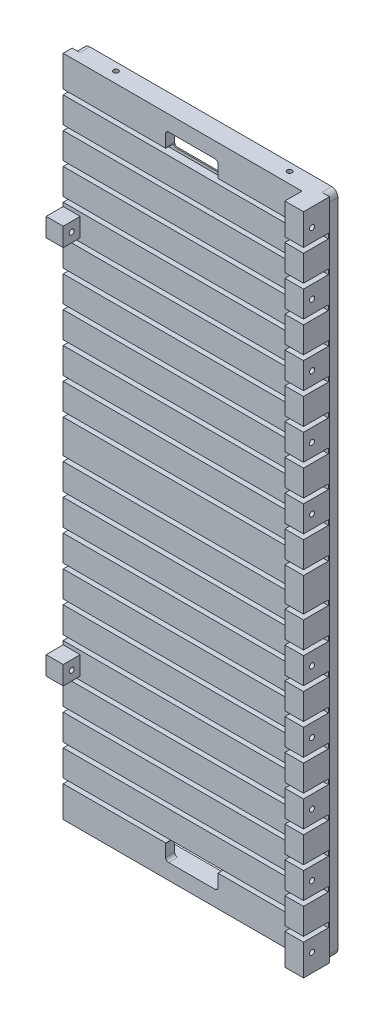
from build123d import *

# Parameters (mm, degrees)
SKETCH1_W                 = 83
SKETCH1_H                 = 214
BOSS_EXTRUDE1_DEPTH       = 8.4
SKETCH2_W                 = 77
SKETCH2_H                 = 5.5
CUT_EXTRUDE1_DEPTH        = 219.148596145
SKETCH3_W                 = 8
SKETCH3_H                 = 1.6
CUT_EXTRUDE2_DEPTH        = 136.678148572
LPATTERN1_COUNT           = 10
LPATTERN1_PITCH           = 10
MIRROR1_COPY_1_SKETCH_W   = 8
MIRROR1_COPY_1_SKETCH_H   = 1.6
MIRROR1_COPY_1_DEPTH      = 136.678148572
MIRROR1_COPY_2_SKETCH_W   = 8
MIRROR1_COPY_2_SKETCH_H   = 1.6
MIRROR1_COPY_2_DEPTH      = 136.678148572
MIRROR1_COPY_3_SKETCH_W   = 8
MIRROR1_COPY_3_SKETCH_H   = 1.6
MIRROR1_COPY_3_DEPTH      = 136.678148572
MIRROR1_COPY_4_SKETCH_W   = 8
MIRROR1_COPY_4_SKETCH_H   = 1.6
MIRROR1_COPY_4_DEPTH      = 136.678148572
MIRROR1_COPY_5_SKETCH_W   = 8
MIRROR1_COPY_5_SKETCH_H   = 1.6
MIRROR1_COPY_5_DEPTH      = 136.678148572
MIRROR1_COPY_6_SKETCH_W   = 8
MIRROR1_COPY_6_SKETCH_H   = 1.6
MIRROR1_COPY_6_DEPTH      = 136.678148572
MIRROR1_COPY_7_SKETCH_W   = 8
MIRROR1_COPY_7_SKETCH_H   = 1.6
MIRROR1_COPY_7_DEPTH      = 136.678148572
MIRROR1_COPY_8_SKETCH_W   = 8
MIRROR1_COPY_8_SKETCH_H   = 1.6
MIRROR1_COPY_8_DEPTH      = 136.678148572
MIRROR1_COPY_9_SKETCH_W   = 8
MIRROR1_COPY_9_SKETCH_H   = 1.6
MIRROR1_COPY_9_DEPTH      = 136.678148572
MIRROR1_COPY_10_SKETCH_W  = 8
MIRROR1_COPY_10_SKETCH_H  = 1.6
MIRROR1_COPY_10_DEPTH     = 136.678148572
BOSS_EXTRUDE2_DEPTH       = 3.18
SKETCH5_W                 = 5.5
SKETCH5_H                 = 6
BOSS_EXTRUDE3_DEPTH       = 5.5
CUT_EXTRUDE3_DEPTH        = 116.073063746
M2X0_4_TAPPED_HOLE1_D     = 1.6
M2X0_4_TAPPED_HOLE2_D     = 1.6
M2X0_4_TAPPED_HOLE2_DEPTH = 4
M2X0_4_TAPPED_HOLE2_TIP   = 0.480688495


with BuildPart() as part:
    # Sketch1 → Boss-Extrude1 (new body)
    with BuildSketch(Plane.XY):
        Rectangle(SKETCH1_W, SKETCH1_H)
    extrude(amount=BOSS_EXTRUDE1_DEPTH)

    # Sketch2 → Cut-Extrude1 (cut, through all)
    with BuildSketch(Plane(origin=(0, 107, 0), x_dir=(1, 0, 0), z_dir=(0, 1, 0))):
        with Locations((-3, -5.65)):
            Rectangle(SKETCH2_W, SKETCH2_H)
    extrude(amount=-CUT_EXTRUDE1_DEPTH, mode=Mode.SUBTRACT)

    # Sketch3 → Cut-Extrude2 (cut, through all)
    with BuildSketch(Plane(origin=(41.5, 0, 0), x_dir=(0, 0, -1), z_dir=(1, 0, 0))):
        with Locations((-4.4, 96.2)):
            Rectangle(SKETCH3_W, SKETCH3_H)
    cut_extrude2 = extrude(amount=-CUT_EXTRUDE2_DEPTH, mode=Mode.SUBTRACT)

    # LPattern1: Cut-Extrude2 ×10
    with Locations(*[(0, -i * LPATTERN1_PITCH, 0) for i in range(1, LPATTERN1_COUNT)]):
        add(cut_extrude2, mode=Mode.SUBTRACT)

    # Mirror1 copy 1 sketch → Mirror1 copy 1 (cut, through all)
    with BuildSketch(Plane(origin=(41.5, 10, 0), x_dir=(0, 0, -1), z_dir=(1, 0, 0))):
        with Locations((-4.4, -96.2)):
            Rectangle(MIRROR1_COPY_1_SKETCH_W, MIRROR1_COPY_1_SKETCH_H)
    extrude(amount=-MIRROR1_COPY_1_DEPTH, mode=Mode.SUBTRACT)

    # Mirror1 copy 2 sketch → Mirror1 copy 2 (cut, through all)
    with BuildSketch(Plane(origin=(41.5, 20, 0), x_dir=(0, 0, -1), z_dir=(1, 0, 0))):
        with Locations((-4.4, -96.2)):
            Rectangle(MIRROR1_COPY_2_SKETCH_W, MIRROR1_COPY_2_SKETCH_H)
    extrude(amount=-MIRROR1_COPY_2_DEPTH, mode=Mode.SUBTRACT)

    # Mirror1 copy 3 sketch → Mirror1 copy 3 (cut, through all)
    with BuildSketch(Plane(origin=(41.5, 30, 0), x_dir=(0, 0, -1), z_dir=(1, 0, 0))):
        with Locations((-4.4, -96.2)):
            Rectangle(MIRROR1_COPY_3_SKETCH_W, MIRROR1_COPY_3_SKETCH_H)
    extrude(amount=-MIRROR1_COPY_3_DEPTH, mode=Mode.SUBTRACT)

    # Mirror1 copy 4 sketch → Mirror1 copy 4 (cut, through all)
    with BuildSketch(Plane(origin=(41.5, 40, 0), x_dir=(0, 0, -1), z_dir=(1, 0, 0))):
        with Locations((-4.4, -96.2)):
            Rectangle(MIRROR1_COPY_4_SKETCH_W, MIRROR1_COPY_4_SKETCH_H)
    extrude(amount=-MIRROR1_COPY_4_DEPTH, mode=Mode.SUBTRACT)

    # Mirror1 copy 5 sketch → Mirror1 copy 5 (cut, through all)
    with BuildSketch(Plane(origin=(41.5, 50, 0), x_dir=(0, 0, -1), z_dir=(1, 0, 0))):
        with Locations((-4.4, -96.2)):
            Rectangle(MIRROR1_COPY_5_SKETCH_W, MIRROR1_COPY_5_SKETCH_H)
    extrude(amount=-MIRROR1_COPY_5_DEPTH, mode=Mode.SUBTRACT)

    # Mirror1 copy 6 sketch → Mirror1 copy 6 (cut, through all)
    with BuildSketch(Plane(origin=(41.5, 60, 0), x_dir=(0, 0, -1), z_dir=(1, 0, 0))):
        with Locations((-4.4, -96.2)):
            Rectangle(MIRROR1_COPY_6_SKETCH_W, MIRROR1_COPY_6_SKETCH_H)
    extrude(amount=-MIRROR1_COPY_6_DEPTH, mode=Mode.SUBTRACT)

    # Mirror1 copy 7 sketch → Mirror1 copy 7 (cut, through all)
    with BuildSketch(Plane(origin=(41.5, 70, 0), x_dir=(0, 0, -1), z_dir=(1, 0, 0))):
        with Locations((-4.4, -96.2)):
            Rectangle(MIRROR1_COPY_7_SKETCH_W, MIRROR1_COPY_7_SKETCH_H)
    extrude(amount=-MIRROR1_COPY_7_DEPTH, mode=Mode.SUBTRACT)

    # Mirror1 copy 8 sketch → Mirror1 copy 8 (cut, through all)
    with BuildSketch(Plane(origin=(41.5, 80, 0), x_dir=(0, 0, -1), z_dir=(1, 0, 0))):
        with Locations((-4.4, -96.2)):
            Rectangle(MIRROR1_COPY_8_SKETCH_W, MIRROR1_COPY_8_SKETCH_H)
    extrude(amount=-MIRROR1_COPY_8_DEPTH, mode=Mode.SUBTRACT)

    # Mirror1 copy 9 sketch → Mirror1 copy 9 (cut, through all)
    with BuildSketch(Plane(origin=(41.5, 90, 0), x_dir=(0, 0, -1), z_dir=(1, 0, 0))):
        with Locations((-4.4, -96.2)):
            Rectangle(MIRROR1_COPY_9_SKETCH_W, MIRROR1_COPY_9_SKETCH_H)
    extrude(amount=-MIRROR1_COPY_9_DEPTH, mode=Mode.SUBTRACT)

    # Mirror1 copy 10 sketch → Mirror1 copy 10 (cut, through all)
    with BuildSketch(Plane(origin=(41.5, 0, 0), x_dir=(0, 0, -1), z_dir=(1, 0, 0))):
        with Locations((-4.4, -96.2)):
            Rectangle(MIRROR1_COPY_10_SKETCH_W, MIRROR1_COPY_10_SKETCH_H)
    extrude(amount=-MIRROR1_COPY_10_DEPTH, mode=Mode.SUBTRACT)

    # Sketch4 → Boss-Extrude2 (add)
    with BuildSketch(Plane(origin=(0, 0, 0), x_dir=(-1, 0, 0), z_dir=(0, 0, -1))):
        with BuildLine():
            Line((-39, 107), (39, 107))
            ThreePointArc((39, 107), (40.414213562, 106.414213562), (41, 105))
            Line((41, 105), (41, -105))
            ThreePointArc((41, -105), (40.414213562, -106.414213562), (39, -107))
            Line((39, -107), (-39, -107))
            ThreePointArc((-39, -107), (-40.414213562, -106.414213562), (-41, -105))
            Line((-41, -105), (-41, 105))
            ThreePointArc((-41, 105), (-40.414213562, 106.414213562), (-39, 107))
        make_face()
        with BuildLine():
            Line((-33.5, -102), (33.5, -102))
            ThreePointArc((33.5, -102), (34.914213562, -101.414213562), (35.5, -100))
            Line((35.5, -100), (35.5, 100))
            ThreePointArc((35.5, 100), (34.914213562, 101.414213562), (33.5, 102))
            Line((33.5, 102), (-33.5, 102))
            ThreePointArc((-33.5, 102), (-34.914213562, 101.414213562), (-35.5, 100))
            Line((-35.5, 100), (-35.5, -100))
            ThreePointArc((-35.5, -100), (-34.914213562, -101.414213562), (-33.5, -102))
        make_face(mode=Mode.SUBTRACT)
    extrude(amount=BOSS_EXTRUDE2_DEPTH)

    # Sketch5 → Boss-Extrude3 (add)
    with BuildSketch(Plane.XY.offset(2.9)):
        with Locations((-38.75, 61.2)):
            Rectangle(SKETCH5_W, SKETCH5_H)
    boss_extrude3 = extrude(amount=BOSS_EXTRUDE3_DEPTH)

    # Mirror2: Boss-Extrude3 across plane
    add(boss_extrude3.mirror(Plane.ZX))

    # Sketch6 → Cut-Extrude3 (cut, through all)
    with BuildSketch(Plane(origin=(0, 0, 0), x_dir=(-1, 0, 0), z_dir=(0, 0, -1))):
        with BuildLine():
            Line((-7.475, 96.3), (7.475, 96.3))
            ThreePointArc((7.475, 96.3), (8.182106781, 96.592893219), (8.475, 97.3))
            Line((8.475, 97.3), (8.475, 101))
            ThreePointArc((8.475, 101), (8.182106781, 101.707106781), (7.475, 102))
            Line((7.475, 102), (-7.475, 102))
            ThreePointArc((-7.475, 102), (-8.182106781, 101.707106781), (-8.475, 101))
            Line((-8.475, 101), (-8.475, 97.3))
            ThreePointArc((-8.475, 97.3), (-8.182106781, 96.592893219), (-7.475, 96.3))
        make_face()
    cut_extrude3 = extrude(amount=-CUT_EXTRUDE3_DEPTH, mode=Mode.SUBTRACT)

    # Mirror3: Cut-Extrude3 across plane
    add(cut_extrude3.mirror(Plane.ZX), mode=Mode.SUBTRACT)

    # M2x0.4 Tapped Hole1 (through all)
    with Locations(Plane(origin=(41.5, 0, 0), x_dir=(0, 0, -1), z_dir=(1, 0, 0))):
        with Locations((-5.65, 101.2), (-5.65, 81.2), (-5.65, 61.2), (-5.65, 41.2), (-5.65, 21.2), (-5.65, -101.2), (-5.65, -81.2), (-5.65, -61.2), (-5.65, -41.2), (-5.65, -21.2)):
            Hole(M2X0_4_TAPPED_HOLE1_D / 2)

    # M2x0.4 Tapped Hole2
    with Locations(Plane(origin=(0, 0, -3.18), x_dir=(-1, 0, 0), z_dir=(0, 0, -1))):
        with Locations((-37.5, 101.2), (37.5, 101.2), (37.5, 81.2), (37.5, 61.2), (37.5, 41.2), (37.5, 21.2), (-37.5, 81.2), (-37.5, 61.2), (-37.5, 41.2), (-37.5, 21.2), (37.5, -101.2), (-37.5, -21.2), (-37.5, -41.2), (-37.5, -61.2), (-37.5, -81.2), (37.5, -21.2), (37.5, -41.2), (37.5, -61.2), (37.5, -81.2), (-37.5, -101.2)):
            Hole(M2X0_4_TAPPED_HOLE2_D / 2, depth=M2X0_4_TAPPED_HOLE2_DEPTH)
            with Locations((0, 0, -(M2X0_4_TAPPED_HOLE2_DEPTH + M2X0_4_TAPPED_HOLE2_TIP / 2))):  # 118° drill point
                Cone(0, M2X0_4_TAPPED_HOLE2_D / 2, M2X0_4_TAPPED_HOLE2_TIP, mode=Mode.SUBTRACT)

    # Sketch14 → M2x0.4 Tapped Hole3 (revolve, cut)
    with BuildSketch(Plane(origin=(28, -107, -0.6), x_dir=(0, 0, -1), z_dir=(1, 0, 0))):
        Polygon((0, 0), (0, 3.980688495), (0.8, 3.5), (0.8, 0), align=None)
    m2x0_4_tapped_hole3 = revolve(axis=Axis((28, -113.35, -0.6), (0, 1, 0)), mode=Mode.SUBTRACT)

    # Mirror4: M2x0.4 Tapped Hole3 across plane
    add(m2x0_4_tapped_hole3.mirror(Plane(origin=(0, 0, 0), x_dir=(0, 0, 1), z_dir=(1, 0, 0))), mode=Mode.SUBTRACT)

    # Mirror5 copy 1 sketch → Mirror5 copy 1 (revolve, cut)
    with BuildSketch(Plane(origin=(-28, 107, -0.6), x_dir=(0, 0, -1), z_dir=(-1, 0, 0))):
        Polygon((0, 0), (0, 3.980688495), (0.8, 3.5), (0.8, 0), align=None)
    revolve(axis=Axis((-28, 113.35, -0.6), (0, -1, 0)), mode=Mode.SUBTRACT)

    # Mirror5 copy 2 sketch → Mirror5 copy 2 (revolve, cut)
    with BuildSketch(Plane(origin=(28, 107, -0.6), x_dir=(0, 0, -1), z_dir=(1, 0, 0))):
        Polygon((0, 0), (0, -3.980688495), (0.8, -3.5), (0.8, 0), align=None)
    revolve(axis=Axis((28, 113.35, -0.6), (0, 1, 0)), mode=Mode.SUBTRACT)


solid = part.part
